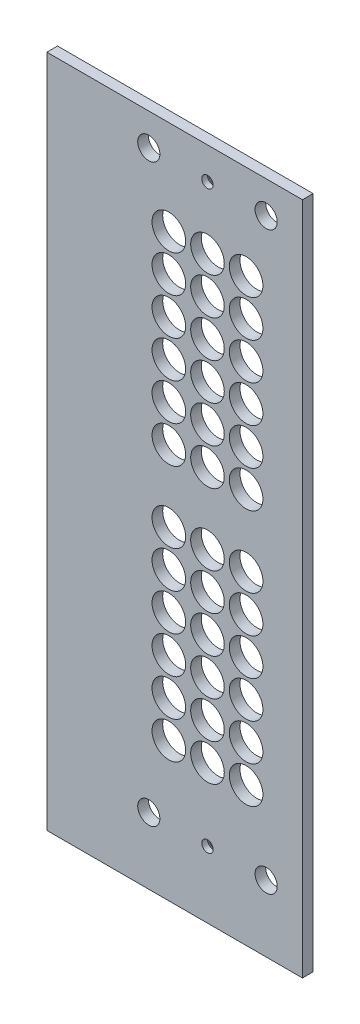
from build123d import *

# Parameters (mm, degrees)
SKETCH1_W                                       = 56.55
SKETCH1_H                                       = 197.425
BOSS_EXTRUDE1_DEPTH                             = 3.175
SKETCH2_R                                       = 5
CUT_EXTRUDE1_DEPTH                              = 10
LPATTERN1_COUNT                                 = 6
LPATTERN1_PITCH                                 = 11
SKETCH5_W                                       = 3.175
SKETCH5_H                                       = 197.425
BOSS_EXTRUDE2_DEPTH                             = 19.525
M6_CLEARANCE_HOLE1_D                            = 6.6
CSK_FOR_M3_FLAT_HEAD_MACHINE_SCREW2_D           = 3.4
CSK_FOR_M3_FLAT_HEAD_MACHINE_SCREW2_CSINK_D     = 6.3
CSK_FOR_M3_FLAT_HEAD_MACHINE_SCREW2_CSINK_ANGLE = 90
SKETCH14_W                                      = 76.075
SKETCH14_H                                      = 3.175
BOSS_EXTRUDE3_DEPTH                             = 3.175


with BuildPart() as part:
    # Sketch1 → Boss-Extrude1 (new body)
    with BuildSketch(Plane.XY):
        Rectangle(SKETCH1_W, SKETCH1_H)
    extrude(amount=BOSS_EXTRUDE1_DEPTH)

    # Sketch2 → Cut-Extrude1 (cut)
    with BuildSketch(Plane(origin=(0, 0, 0), x_dir=(-1, 0, 0), z_dir=(0, 0, -1))):
        with Locations((11.5, -57.369162839)):
            Circle(SKETCH2_R)
        with Locations((-11.5, -57.369162839)):
            Circle(SKETCH2_R)
        with Locations((0, -57.369162839)):
            Circle(SKETCH2_R)
        with Locations((0, 18.830837161)):
            Circle(SKETCH2_R)
        with Locations((-11.5, 18.830837161)):
            Circle(SKETCH2_R)
        with Locations((11.5, 18.830837161)):
            Circle(SKETCH2_R)
    cut_extrude1 = extrude(amount=-CUT_EXTRUDE1_DEPTH, mode=Mode.SUBTRACT)

    # LPattern1: Cut-Extrude1 ×6
    with Locations(*[(0, i * LPATTERN1_PITCH, 0) for i in range(1, LPATTERN1_COUNT)]):
        add(cut_extrude1, mode=Mode.SUBTRACT)

    # Sketch5 → Boss-Extrude2 (add)
    with BuildSketch(Plane.ZY.offset(28.275)):
        with Locations((1.5875, 0)):
            Rectangle(SKETCH5_W, SKETCH5_H)
    extrude(amount=BOSS_EXTRUDE2_DEPTH)

    # M6 Clearance Hole1 (through all)
    with Locations(Plane.XY.offset(3.175)):
        with Locations((-17.4625, -78.8874999), (17.4625, -78.8874999), (-17.4625, 92.3625001), (17.4625, 92.3625001)):
            Hole(M6_CLEARANCE_HOLE1_D / 2)

    # CSK for M3 Flat Head Machine Screw2 (through all)
    with Locations(Plane(origin=(0, 0, 0), x_dir=(-1, 0, 0), z_dir=(0, 0, -1))):
        with Locations((0, -78.8874999), (0, 92.3625001)):
            CounterSinkHole(CSK_FOR_M3_FLAT_HEAD_MACHINE_SCREW2_D / 2, CSK_FOR_M3_FLAT_HEAD_MACHINE_SCREW2_CSINK_D / 2, counter_sink_angle=CSK_FOR_M3_FLAT_HEAD_MACHINE_SCREW2_CSINK_ANGLE)

    # Sketch14 → Boss-Extrude3 (add)
    with BuildSketch(Plane(origin=(0, 98.7125, 0), x_dir=(1, 0, 0), z_dir=(0, 1, 0))):
        with Locations((-9.7625, -1.5875)):
            Rectangle(SKETCH14_W, SKETCH14_H)
    extrude(amount=BOSS_EXTRUDE3_DEPTH)


solid = part.part
